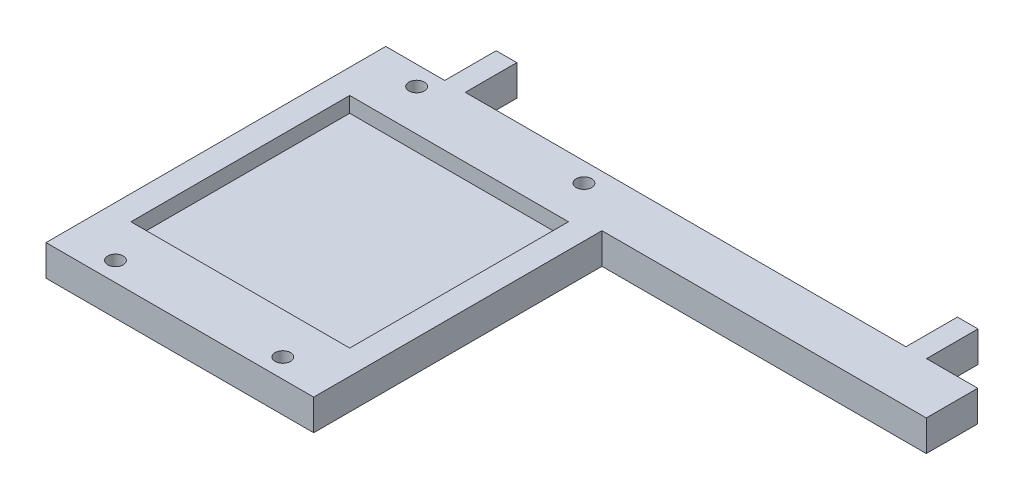
from build123d import *

# Parameters (mm, degrees)
SKETCH1_W           = 52
SKETCH1_H           = 66
BOSS_EXTRUDE1_DEPTH = 6
SKETCH2_W           = 42.5
SKETCH2_H           = 42.5
CUT_EXTRUDE1_DEPTH  = 3
SKETCH3_R           = 1.5
CUT_EXTRUDE2_DEPTH  = 13
SKETCH4_W           = 10
SKETCH4_H           = 6
BOSS_EXTRUDE2_DEPTH = 63
SKETCH5_W           = 4
SKETCH5_H           = 6
BOSS_EXTRUDE3_DEPTH = 10


with BuildPart() as part:
    # Sketch1 → Boss-Extrude1 (new body)
    with BuildSketch(Plane(origin=(0, 0, 0), x_dir=(1, 0, 0), z_dir=(0, 1, 0))):
        with Locations((-26, -33)):
            Rectangle(SKETCH1_W, SKETCH1_H)
    extrude(amount=BOSS_EXTRUDE1_DEPTH)

    # Sketch2 → Cut-Extrude1 (cut)
    with BuildSketch(Plane(origin=(0, 6, 0), x_dir=(1, 0, 0), z_dir=(0, 1, 0))):
        with Locations((-26, -33)):
            Rectangle(SKETCH2_W, SKETCH2_H)
    extrude(amount=-CUT_EXTRUDE1_DEPTH, mode=Mode.SUBTRACT)

    # Sketch3 → Cut-Extrude2 (cut)
    with BuildSketch(Plane(origin=(0, 6, 0), x_dir=(1, 0, 0), z_dir=(0, 1, 0))):
        with Locations((-42.25, -3.75)):
            Circle(SKETCH3_R)
        with Locations((-9.75, -3.75)):
            Circle(SKETCH3_R)
        with Locations((-9.75, -62.25)):
            Circle(SKETCH3_R)
        with Locations((-42.25, -62.25)):
            Circle(SKETCH3_R)
    extrude(amount=-CUT_EXTRUDE2_DEPTH, mode=Mode.SUBTRACT)

    # Sketch4 → Boss-Extrude2 (add)
    with BuildSketch(Plane(origin=(0, 0, 0), x_dir=(0, 0, -1), z_dir=(1, 0, 0))):
        with Locations((-5, 3)):
            Rectangle(SKETCH4_W, SKETCH4_H)
    extrude(amount=BOSS_EXTRUDE2_DEPTH)

    # Sketch5 → Boss-Extrude3 (add)
    with BuildSketch(Plane(origin=(0, 0, 0), x_dir=(-1, 0, 0), z_dir=(0, 0, -1))):
        with Locations((38.55, 3)):
            Rectangle(SKETCH5_W, SKETCH5_H)
        with Locations((-51.05, 3)):
            Rectangle(SKETCH5_W, SKETCH5_H)
    extrude(amount=BOSS_EXTRUDE3_DEPTH)


solid = part.part
